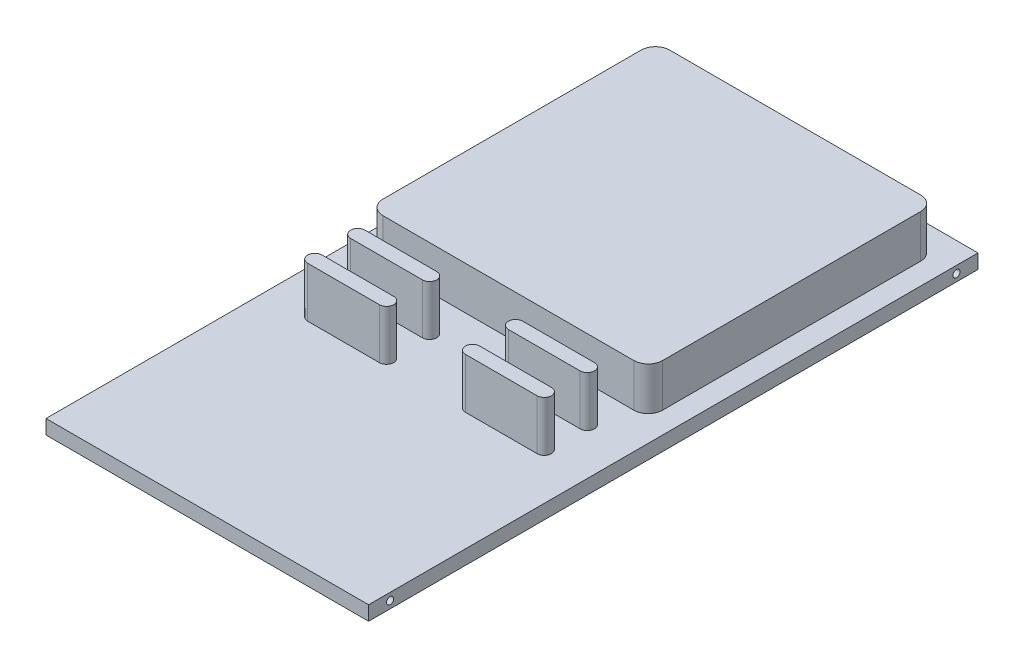
from build123d import *

# Parameters (mm, degrees)
SKETCH1_W           = 57.15
SKETCH1_H           = 107.95
BOSS_EXTRUDE1_DEPTH = 2.54
BOSS_EXTRUDE2_DEPTH = 8.89
SKETCH4_R           = 0.635
CUT_EXTRUDE1_DEPTH  = 10.16
SKETCH5_W           = 49.53
SKETCH5_H           = 50.8
BOSS_EXTRUDE3_DEPTH = 7.62
FILLET1_R           = 2.54


with BuildPart() as part:
    # Sketch1 → Boss-Extrude1 (new body)
    with BuildSketch(Plane(origin=(0, 0, 0), x_dir=(1, 0, 0), z_dir=(0, 1, 0))):
        with Locations((28.575, 53.975)):
            Rectangle(SKETCH1_W, SKETCH1_H)
    extrude(amount=BOSS_EXTRUDE1_DEPTH)

    # Sketch2 → Boss-Extrude2 (add)
    with BuildSketch(Plane(origin=(0, 2.54, 0), x_dir=(1, 0, 0), z_dir=(0, 1, 0))):
        with BuildLine():
            Line((8.255, 40.64), (20.955, 40.64))
            ThreePointArc((20.955, 40.64), (22.225, 39.37), (20.955, 38.1))
            Line((20.955, 38.1), (8.255, 38.1))
            ThreePointArc((8.255, 38.1), (6.985, 39.37), (8.255, 40.64))
        make_face()
        with BuildLine():
            Line((48.895, 40.64), (36.195, 40.64))
            ThreePointArc((36.195, 40.64), (34.925, 39.37), (36.195, 38.1))
            Line((36.195, 38.1), (48.895, 38.1))
            ThreePointArc((48.895, 38.1), (50.165, 39.37), (48.895, 40.64))
        make_face()
        with BuildLine():
            Line((8.255, 48.26), (20.955, 48.26))
            ThreePointArc((20.955, 48.26), (22.225, 46.99), (20.955, 45.72))
            Line((20.955, 45.72), (8.255, 45.72))
            ThreePointArc((8.255, 45.72), (6.985, 46.99), (8.255, 48.26))
        make_face()
        with BuildLine():
            Line((48.895, 48.26), (36.195, 48.26))
            ThreePointArc((36.195, 48.26), (34.925, 46.99), (36.195, 45.72))
            Line((36.195, 45.72), (48.895, 45.72))
            ThreePointArc((48.895, 45.72), (50.165, 46.99), (48.895, 48.26))
        make_face()
    extrude(amount=BOSS_EXTRUDE2_DEPTH)

    # Sketch4 → Cut-Extrude1 (cut)
    with BuildSketch(Plane.ZY):
        with Locations((-104.14, 1.27)):
            Circle(SKETCH4_R)
        with Locations((-3.81, 1.27)):
            Circle(SKETCH4_R)
    cut_extrude1 = extrude(amount=-CUT_EXTRUDE1_DEPTH, mode=Mode.SUBTRACT)

    # Mirror1: Cut-Extrude1 across plane
    add(cut_extrude1.mirror(Plane.ZY.offset(-28.575)), mode=Mode.SUBTRACT)

    # Sketch5 → Boss-Extrude3 (add)
    with BuildSketch(Plane(origin=(0, 2.54, 0), x_dir=(1, 0, 0), z_dir=(0, 1, 0))):
        with Locations((28.575, 78.74)):
            Rectangle(SKETCH5_W, SKETCH5_H)
    extrude(amount=BOSS_EXTRUDE3_DEPTH)

    # Fillet1
    fillet1_edges = [part.edges().sort_by_distance(p)[0] for p in [
        (53.34, 6.35, -53.34),
        (53.34, 6.35, -104.14),
        (3.81, 6.35, -104.14),
        (3.81, 6.35, -53.34),
    ]]
    fillet(fillet1_edges, radius=FILLET1_R)


solid = part.part
